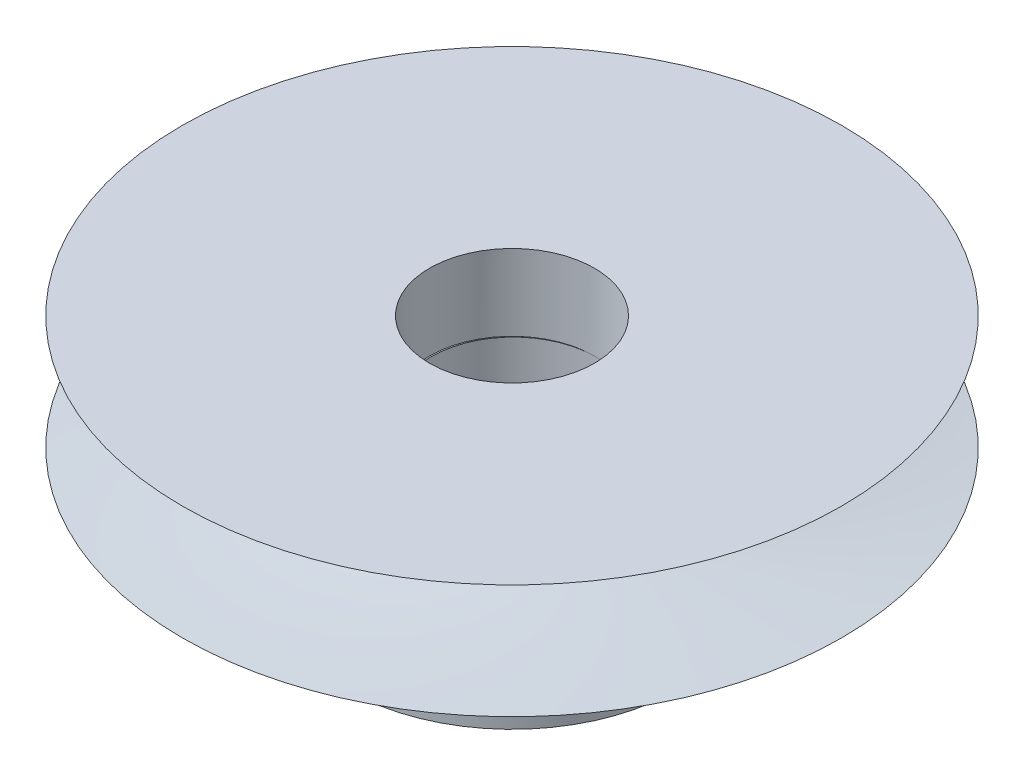
from build123d import *

# Parameters (mm, degrees)
SKETCH117_R           = 3.25
CUT_EXTRUDE4_DEPTH    = 3
SKETCH122_R           = 6.539767279
BOSS_EXTRUDE1_DEPTH   = 5
M2X0_4_TAPPED_HOLE1_D = 1.6
SKETCH125_R           = 3.25
CUT_EXTRUDE5_DEPTH    = 7


with BuildPart() as part:
    # Sketch9 → Revolve1 (revolve)
    with BuildSketch(Plane.XY):
        with BuildLine():
            Line((-4.703089141, -2.935363462), (8.296910859, -2.935363462))
            Line((8.296910859, -2.935363462), (8.296910859, 1.564636538))
            Line((8.296910859, 1.564636538), (-4.703089141, 1.564636538))
            add(Edge.make_bspline(
                [(-4.703089141, 1.564636538), (8.296910859, -1.435363462), (-4.703089141, -2.935363462)],
                knots=[0, 0, 0, 1, 1, 1], degree=2))
        make_face()
    revolve(axis=Axis((8.296910859, -2.935363462, 0), (0, 1, 0)))

    # Sketch117 → Cut-Extrude4 (cut)
    with BuildSketch(Plane(origin=(0, 1.564636538, 0), x_dir=(1, 0, 0), z_dir=(0, 1, 0))):
        with Locations((8.29691086, 0)):
            Circle(SKETCH117_R)
    extrude(amount=-CUT_EXTRUDE4_DEPTH, mode=Mode.SUBTRACT)

    # Sketch122 → Boss-Extrude1 (add)
    with BuildSketch(Plane(origin=(0, -2.935363462, 0), x_dir=(-1, 0, 0), z_dir=(0, -1, 0))):
        with Locations((-8.29691086, 0)):
            Circle(SKETCH122_R)
    extrude(amount=BOSS_EXTRUDE1_DEPTH)

    # M2x0.4 Tapped Hole1 (through all)
    with Locations(Plane(origin=(1.815385484, -5.431649491, -0.870852953), x_dir=(0.133162682309, 0, -0.991094193324), z_dir=(-0.991094193324, 0, -0.133162682309))):
        with Locations((0, 0)):
            Hole(M2X0_4_TAPPED_HOLE1_D / 2)

    # Sketch125 → Cut-Extrude5 (cut)
    with BuildSketch(Plane(origin=(0, -1.435363462, 0), x_dir=(1, 0, 0), z_dir=(0, 1, 0))):
        with Locations((8.350281981, 0)):
            Circle(SKETCH125_R)
    extrude(amount=-CUT_EXTRUDE5_DEPTH, mode=Mode.SUBTRACT)


solid = part.part
